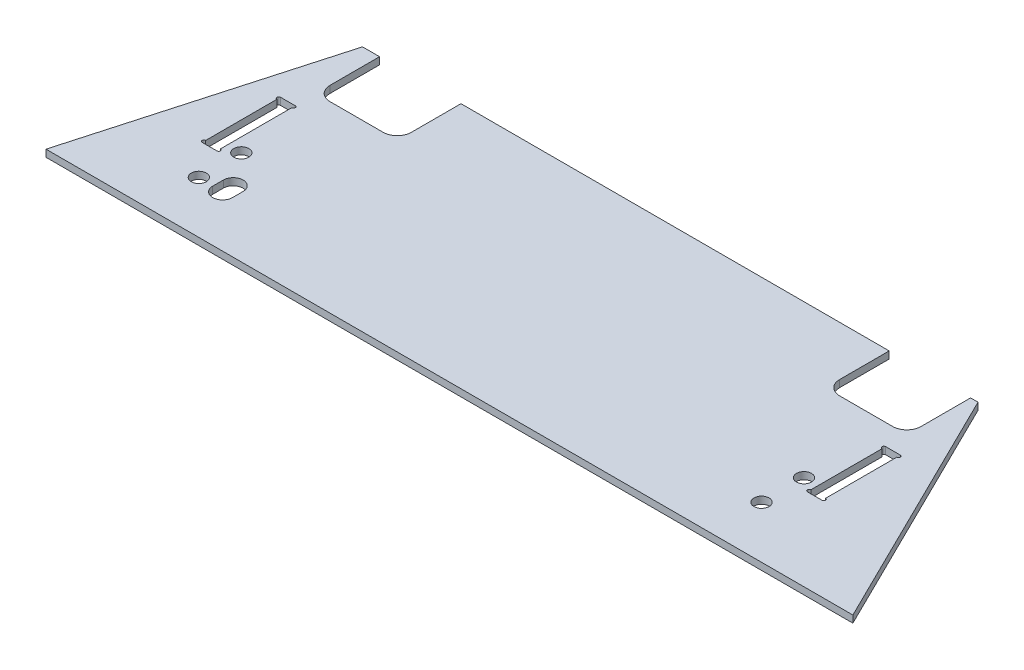
from build123d import *

# Parameters (mm, degrees)
SKETCH1_W                       = 361.95
SKETCH1_H                       = 110.744
BOSS_EXTRUDE1_DEPTH             = 3.175
CUT_EXTRUDE1_DEPTH              = 379.526243028
SKETCH3_W                       = 36.5125
SKETCH3_H                       = 28.575
CUT_EXTRUDE2_DEPTH              = 379.526243028
FILLET1_R                       = 6.35
F_1_4_CLEARANCE_HOLE1_OUTLINE_R = 3.3782
F_1_4_CLEARANCE_HOLE1_DEPTH     = 3.175
CUT_EXTRUDE6_DEPTH              = 3.175


# Read off the part's stored shape, not the designer's step: 1/4 Clearance Hole1, Cut-Extrude6
with BuildPart() as part:
    # Sketch1 → Boss-Extrude1 (new body)
    with BuildSketch(Plane(origin=(0, 0, 0), x_dir=(1, 0, 0), z_dir=(0, 1, 0))):
        with Locations((180.975, 55.372)):
            Rectangle(SKETCH1_W, SKETCH1_H)
    extrude(amount=BOSS_EXTRUDE1_DEPTH)

    # Sketch2 → Cut-Extrude1 (cut, through all)
    with BuildSketch(Plane(origin=(0, 3.175, 0), x_dir=(1, 0, 0), z_dir=(0, 1, 0))):
        Polygon((0, 0), (31.233038214, 110.744), (0, 110.744), align=None)
        Polygon((361.95, 0), (307.33710294, 110.744), (361.95, 110.744), align=None)
    extrude(amount=-CUT_EXTRUDE1_DEPTH, mode=Mode.SUBTRACT)

    # Sketch3 → Cut-Extrude2 (cut, through all)
    with BuildSketch(Plane(origin=(0, 3.175, 0), x_dir=(1, 0, 0), z_dir=(0, 1, 0))):
        with Locations((57.15, 96.4565)):
            Rectangle(SKETCH3_W, SKETCH3_H)
        with Locations((285.75, 96.4565)):
            Rectangle(SKETCH3_W, SKETCH3_H)
    extrude(amount=-CUT_EXTRUDE2_DEPTH, mode=Mode.SUBTRACT)

    # Fillet1
    fillet1_edges = [part.edges().sort_by_distance(p)[0] for p in [
        (75.40625, 1.5875, -82.169),
        (38.89375, 1.5875, -82.169),
        (304.00625, 1.5875, -82.169),
        (267.49375, 1.5875, -82.169),
    ]]
    fillet(fillet1_edges, radius=FILLET1_R)

    # 1/4 Clearance Hole1 outline → 1/4 Clearance Hole1 (cut)
    with BuildSketch(Plane(origin=(0, 0, 0), x_dir=(1, 0, 0), z_dir=(0, 1, 0))):
        with BuildLine():
            ThreePointArc((51.7525, 23.01875), (56.1975, 18.57375), (60.6425, 23.01875))
            Line((60.6425, 23.01875), (60.6425, 27.78125))
            ThreePointArc((60.6425, 27.78125), (56.1975, 32.22625), (51.7525, 27.78125))
            Line((51.7525, 27.78125), (51.7525, 23.01875))
        make_face()
        with Locations((297.65625, 23.314421689)):
            Circle(F_1_4_CLEARANCE_HOLE1_OUTLINE_R)
        with Locations((297.65625, 42.364421689)):
            Circle(F_1_4_CLEARANCE_HOLE1_OUTLINE_R)
        with Locations((45.24375, 23.314421689)):
            Circle(F_1_4_CLEARANCE_HOLE1_OUTLINE_R)
        with Locations((45.24375, 42.364421689)):
            Circle(F_1_4_CLEARANCE_HOLE1_OUTLINE_R)
    extrude(amount=F_1_4_CLEARANCE_HOLE1_DEPTH, mode=Mode.SUBTRACT)

    # Cut-Extrude6 outline → Cut-Extrude6 (cut)
    with BuildSketch(Plane(origin=(0, 0, 0), x_dir=(1, 0, 0), z_dir=(0, 1, 0))):
        with BuildLine():
            ThreePointArc((39.02075, 71.1835), (39.8145, 71.97725), (39.02075, 72.771))
            Line((39.02075, 72.771), (32.41675, 72.771))
            ThreePointArc((32.41675, 72.771), (31.623, 71.97725), (32.41675, 71.1835))
            Line((32.41675, 71.1835), (32.41675, 39.240862815))
            ThreePointArc((32.41675, 39.240862815), (31.623, 38.447112815), (32.41675, 37.653362815))
            Line((32.41675, 37.653362815), (39.02075, 37.653362815))
            ThreePointArc((39.02075, 37.653362815), (39.8145, 38.447112815), (39.02075, 39.240862815))
            Line((39.02075, 39.240862815), (39.02075, 71.1835))
        make_face()
        with BuildLine():
            ThreePointArc((310.48325, 71.1835), (311.277, 71.97725), (310.48325, 72.771))
            Line((310.48325, 72.771), (303.87925, 72.771))
            ThreePointArc((303.87925, 72.771), (303.0855, 71.97725), (303.87925, 71.1835))
            Line((303.87925, 71.1835), (303.87925, 39.240862815))
            ThreePointArc((303.87925, 39.240862815), (303.0855, 38.447112815), (303.87925, 37.653362815))
            Line((303.87925, 37.653362815), (310.48325, 37.653362815))
            ThreePointArc((310.48325, 37.653362815), (311.277, 38.447112815), (310.48325, 39.240862815))
            Line((310.48325, 39.240862815), (310.48325, 71.1835))
        make_face()
    extrude(amount=CUT_EXTRUDE6_DEPTH, mode=Mode.SUBTRACT)


solid = part.part
